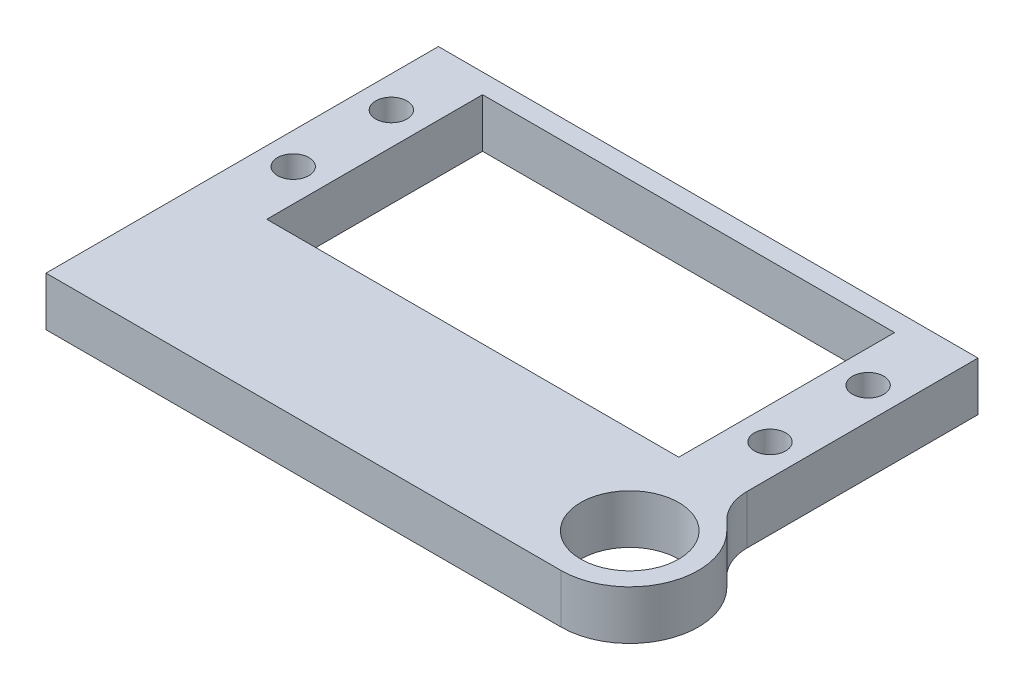
from build123d import *

# Parameters (mm, degrees)
SKETCH1_R           = 5
SKETCH1_R_2         = 1.6
SKETCH1_W           = 42
SKETCH1_H           = 22
BOSS_EXTRUDE1_DEPTH = 5


with BuildPart() as part:
    # Sketch1 → Boss-Extrude1 (new body)
    with BuildSketch(Plane(origin=(0, 0, 0), x_dir=(1, 0, 0), z_dir=(0, 1, 0))):
        with BuildLine():
            ThreePointArc((0, -7), (6.467156728, -2.678784027), (4.949747468, 4.949747468))
            Line((4.949747468, 4.949747468), (3.964466094, 5.935028843))
            ThreePointArc((3.964466094, 5.935028843), (2.880602337, 7.557145587), (2.5, 9.470562748))
            Line((2.5, 9.470562748), (2.5, 33))
            Line((2.5, 33), (-52.5, 33))
            Line((-52.5, 33), (-52.5, -7))
            Line((-52.5, -7), (0, -7))
        make_face()
        Circle(SKETCH1_R, mode=Mode.SUBTRACT)
        with Locations((-49.3, 15)):
            Circle(SKETCH1_R_2, mode=Mode.SUBTRACT)
        with Locations((-25, 20)):
            Rectangle(SKETCH1_W, SKETCH1_H, mode=Mode.SUBTRACT)
        with Locations((-49.3, 25)):
            Circle(SKETCH1_R_2, mode=Mode.SUBTRACT)
        with Locations((-0.7, 15)):
            Circle(SKETCH1_R_2, mode=Mode.SUBTRACT)
        with Locations((-0.7, 25)):
            Circle(SKETCH1_R_2, mode=Mode.SUBTRACT)
    extrude(amount=-BOSS_EXTRUDE1_DEPTH)


solid = part.part
